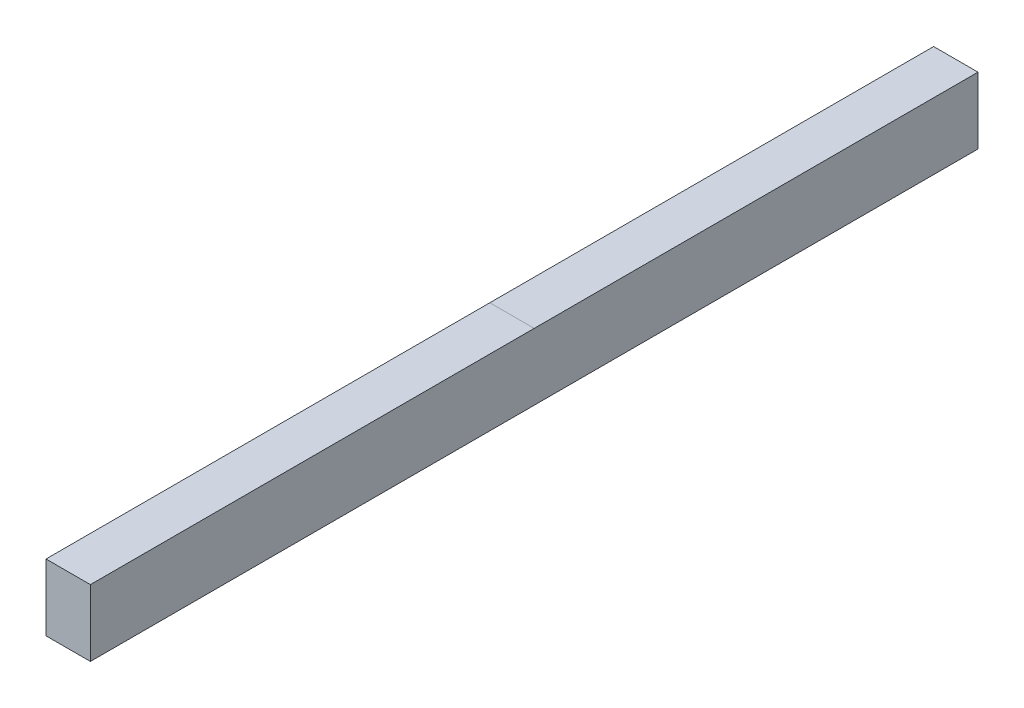
from build123d import *

# Parameters (mm, degrees)
SZKIC2_W                    = 10
SZKIC2_H                    = 15
DODANIE_WYCI_GNI_CIE1_DEPTH = 200
PODZIEL1_SURFACE_1_BACK     = 201.811
PODZIEL1_SURFACE_1_DEPTH    = 403.622
PODZIEL1_SURFACE_2_BACK     = 201.811
PODZIEL1_SURFACE_2_DEPTH    = 403.622
PODZIEL2_OUTLINE_W          = 8.2
PODZIEL2_OUTLINE_H          = 13.4
PODZIEL2_DEPTH              = 0.8
PODZIEL2_START              = 199.2
PODZIEL2_2_OUTLINE_W        = 8.2
PODZIEL2_2_OUTLINE_H        = 13.4
PODZIEL2_2_DEPTH            = 0.8
PODZIEL2_3_OUTLINE_W        = 8.2
PODZIEL2_3_OUTLINE_H        = 13.4
PODZIEL2_3_DEPTH            = 0.8
PODZIEL2_4_OUTLINE_W        = 8.2
PODZIEL2_4_OUTLINE_H        = 13.4
PODZIEL2_4_DEPTH            = 0.8


# Read off the part's stored shape, not the designer's step: Podziel2
with BuildPart() as part:
    # Szkic2 → Dodanie-wyciągnięcie1 (new body)
    with BuildSketch(Plane.XY):
        with Locations((5, 7.5)):
            Rectangle(SZKIC2_W, SZKIC2_H)
    extrude(amount=DODANIE_WYCI_GNI_CIE1_DEPTH)


with BuildPart() as body_2:
    # Podziel1: the piece behind the surface
    add(part.part)
    # Podziel1 surface: a surface, the sketch's curves swept straight by 403.622 mm
    with BuildLine(Plane.XY.offset(-PODZIEL1_SURFACE_1_BACK), mode=Mode.PRIVATE) as podziel1_surface_1_path:
        Line((0.9, 14.2), (9.1, 14.2))
        Line((9.1, 14.2), (9.1, 0.8))
        Line((9.1, 0.8), (0.9, 0.8))
        Line((0.9, 0.8), (0.9, 14.2))
    podziel1_surface_1 = Shell.extrude(podziel1_surface_1_path.wire(), (0 * PODZIEL1_SURFACE_1_DEPTH, 0 * PODZIEL1_SURFACE_1_DEPTH, 1 * PODZIEL1_SURFACE_1_DEPTH))
    split(bisect_by=podziel1_surface_1, keep=Keep.BOTTOM)

    # Podziel2 outline → Podziel2 (cut)
    with BuildSketch(Plane.XY):
        with Locations((5, 7.5)):
            Rectangle(PODZIEL2_OUTLINE_W, PODZIEL2_OUTLINE_H)
    extrude(amount=PODZIEL2_DEPTH, mode=Mode.SUBTRACT)

    # Podziel2 2 outline → Podziel2 2 (cut)
    with BuildSketch(Plane.XY.offset(PODZIEL2_START)):
        with Locations((5, 7.5)):
            Rectangle(PODZIEL2_2_OUTLINE_W, PODZIEL2_2_OUTLINE_H)
    extrude(amount=PODZIEL2_2_DEPTH, mode=Mode.SUBTRACT)


with BuildPart() as part_1:
    add(part.part)

    # Podziel1: split by a surface, the side it looks to stays
    # Podziel1 surface: a surface, the sketch's curves swept straight by 403.622 mm
    with BuildLine(Plane.XY.offset(-PODZIEL1_SURFACE_2_BACK), mode=Mode.PRIVATE) as podziel1_surface_2_path:
        Line((0.9, 14.2), (9.1, 14.2))
        Line((9.1, 14.2), (9.1, 0.8))
        Line((9.1, 0.8), (0.9, 0.8))
        Line((0.9, 0.8), (0.9, 14.2))
    podziel1_surface_2 = Shell.extrude(podziel1_surface_2_path.wire(), (0 * PODZIEL1_SURFACE_2_DEPTH, 0 * PODZIEL1_SURFACE_2_DEPTH, 1 * PODZIEL1_SURFACE_2_DEPTH))
    split(bisect_by=podziel1_surface_2, keep=Keep.TOP)


with BuildPart() as body_3:
    # Podziel2 3 outline → Podziel2 3 (new body)
    with BuildSketch(Plane.XY):
        with Locations((5, 7.5)):
            Rectangle(PODZIEL2_3_OUTLINE_W, PODZIEL2_3_OUTLINE_H)
    extrude(amount=PODZIEL2_3_DEPTH)


with BuildPart() as body_4:
    # Podziel2 4 outline → Podziel2 4 (new body)
    with BuildSketch(Plane.XY.offset(PODZIEL2_START)):
        with Locations((5, 7.5)):
            Rectangle(PODZIEL2_4_OUTLINE_W, PODZIEL2_4_OUTLINE_H)
    extrude(amount=PODZIEL2_4_DEPTH)


with BuildPart() as part_2:
    add(part_1.part)

    # Połącz1: union body 4, body 3
    add(body_4.part)
    add(body_3.part)


solid = Compound([body_2.part, part_2.part])
